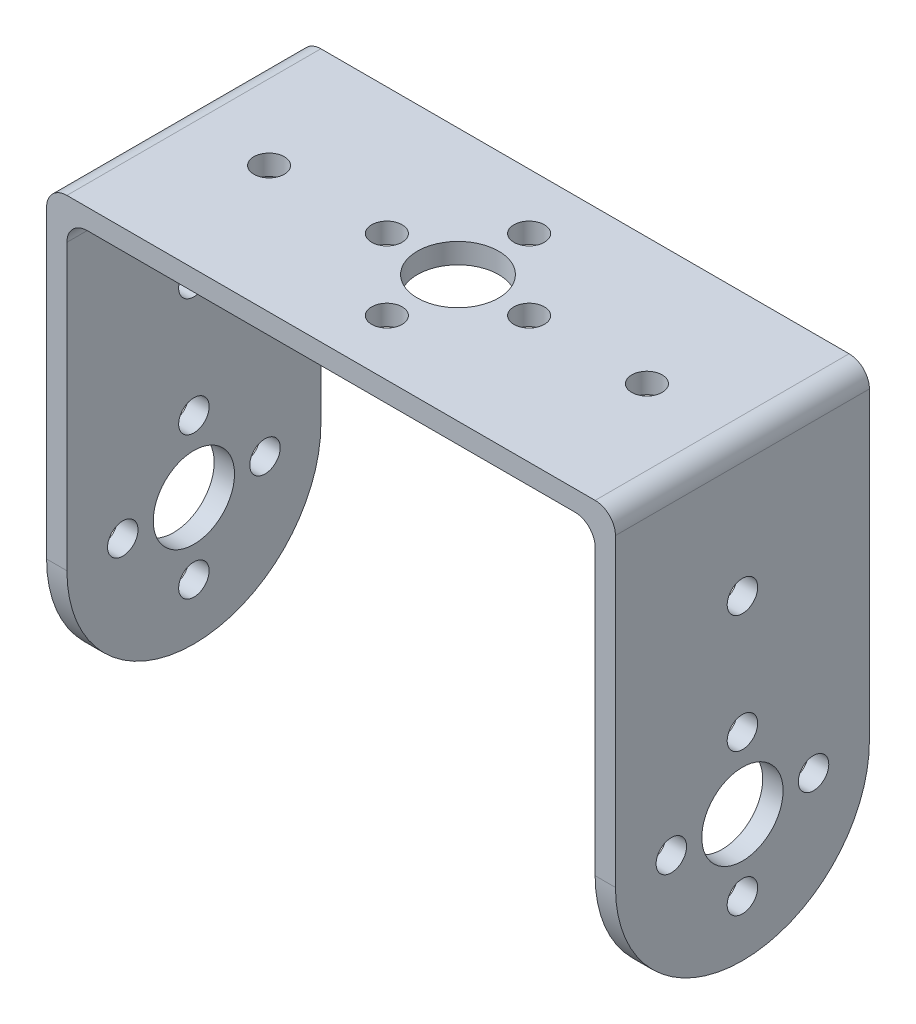
from build123d import *

# Parameters (mm, degrees)
SKETCH_1_W          = 52
SKETCH_1_H          = 25
SKETCH_1_R          = 4
SKETCH_1_R_2        = 1.5
EXTRUDE_1_DEPTH     = 2
SKETCH_2_W          = 2
SKETCH_2_H          = 25
EXTRUDE_2_DEPTH     = 44.5
FILLET_1_R          = 12.5
FILLET_2_R          = 12.5
SKETCH_3_R          = 4
SKETCH_3_R_2        = 1.5
CUT_EXTRUDE_1_DEPTH = 64.5
FILLET_5_R          = 2


with BuildPart() as part:
    # 草图1 → 凸台-拉伸1 (new body)
    with BuildSketch(Plane(origin=(0, 0, 0), x_dir=(1, 0, 0), z_dir=(0, 1, 0))):
        with Locations((-26, 12.5)):
            Rectangle(SKETCH_1_W, SKETCH_1_H)
        with Locations(Location((-26, 12.5, 0), (0, 0, 270))):
            Circle(SKETCH_1_R, mode=Mode.SUBTRACT)
        with Locations(Location((-26, 5.5, 0), (0, 0, 270))):
            Circle(SKETCH_1_R_2, mode=Mode.SUBTRACT)
        with Locations(Location((-33, 12.5, 0), (0, 0, 270))):
            Circle(SKETCH_1_R_2, mode=Mode.SUBTRACT)
        with Locations(Location((-26, 19.5, 0), (0, 0, 270))):
            Circle(SKETCH_1_R_2, mode=Mode.SUBTRACT)
        with Locations(Location((-19, 12.5, 0), (0, 0, 270))):
            Circle(SKETCH_1_R_2, mode=Mode.SUBTRACT)
        with Locations(Location((-7.4, 12.5, 0), (0, 0, 270))):
            Circle(SKETCH_1_R_2, mode=Mode.SUBTRACT)
        with Locations(Location((-44.6, 12.5, 0), (0, 0, 270))):
            Circle(SKETCH_1_R_2, mode=Mode.SUBTRACT)
    extrude(amount=EXTRUDE_1_DEPTH)

    # 草图2 → 凸台-拉伸2 (add)
    with BuildSketch(Plane(origin=(0, 2, 0), x_dir=(1, 0, 0), z_dir=(0, 1, 0))):
        with Locations((-53, 12.5)):
            Rectangle(SKETCH_2_W, SKETCH_2_H)
        with Locations((1, 12.5)):
            Rectangle(SKETCH_2_W, SKETCH_2_H)
    extrude(amount=-EXTRUDE_2_DEPTH)

    # 圆角1
    fillet_1_edges = [part.edges().sort_by_distance(p)[0] for p in [
        (-53, -42.5, -25),
        (-53, -42.5, 0),
    ]]
    fillet(fillet_1_edges, radius=FILLET_1_R - 0.0001)  # a hair under: the kernel refuses the full size

    # 圆角2
    fillet_2_edges = [part.edges().sort_by_distance(p)[0] for p in [
        (1, -42.5, -25),
        (1, -42.5, 0),
    ]]
    fillet(fillet_2_edges, radius=FILLET_2_R - 0.0001)  # a hair under: the kernel refuses the full size

    # 草图3 → 切除-拉伸1 (cut)
    with BuildSketch(Plane(origin=(2, 0, 0), x_dir=(0, 0, -1), z_dir=(1, 0, 0))):
        with Locations((12.5, -30)):
            Circle(SKETCH_3_R)
        with Locations((12.5, -23)):
            Circle(SKETCH_3_R_2)
        with Locations((19.5, -30)):
            Circle(SKETCH_3_R_2)
        with Locations((12.5, -37)):
            Circle(SKETCH_3_R_2)
        with Locations((5.5, -30)):
            Circle(SKETCH_3_R_2)
        with Locations((12.5, -11.4)):
            Circle(SKETCH_3_R_2)
    extrude(amount=-CUT_EXTRUDE_1_DEPTH, mode=Mode.SUBTRACT)

    # 圆角5
    fillet_5_edges = [part.edges().sort_by_distance(p)[0] for p in [
        (-54, 2, -12.5),
        (-52, 0, -12.5),
        (2, 2, -12.5),
        (0, 0, -12.5),
    ]]
    fillet(fillet_5_edges, radius=FILLET_5_R)


solid = part.part
